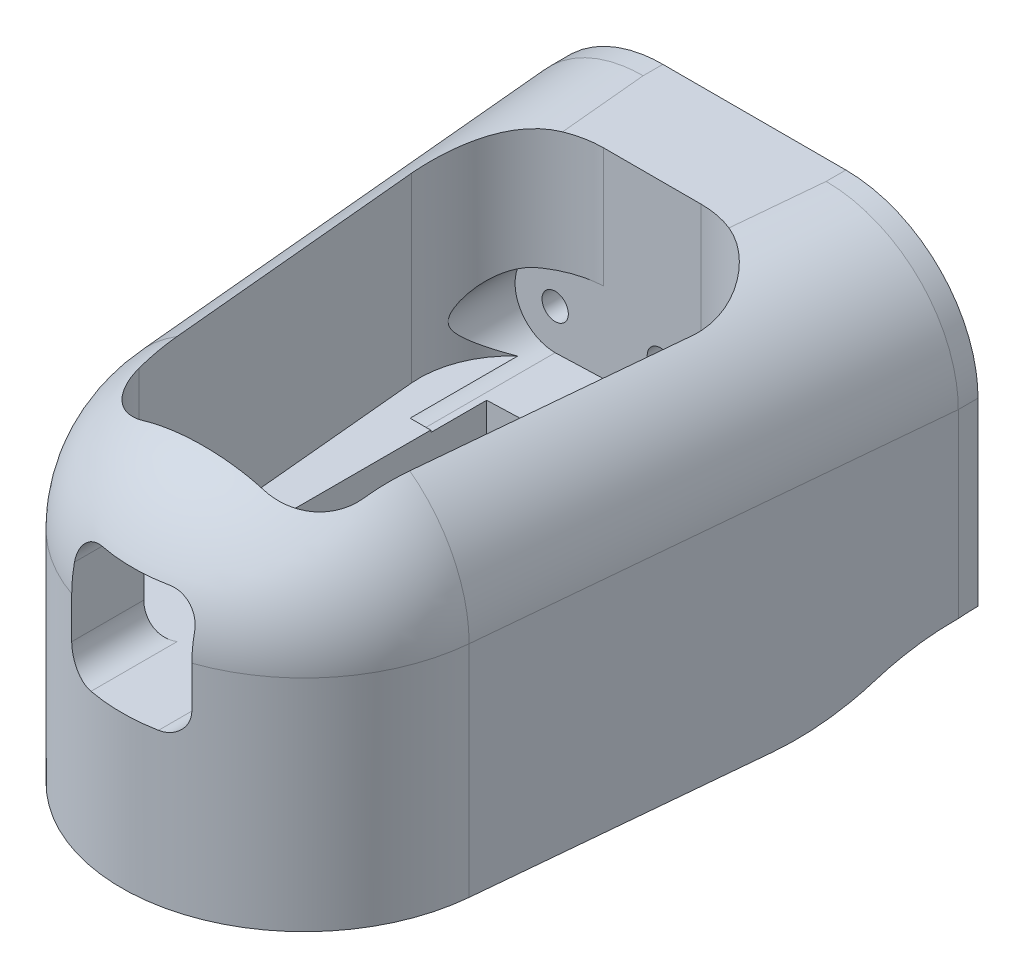
from build123d import *

# Parameters (mm, degrees)
SKETCH1_W               = 34
SKETCH1_H               = 23.7
BOSS_EXTRUDE1_DEPTH     = 46.6
SKETCH2_OUTSIDE_W       = 48.472
SKETCH2_OUTSIDE_H       = 61.072
CUT_EXTRUDE1_DEPTH      = 55.974994316
SERVO_START             = -64.298176616
SERVO_MICRO_OUTLINE_W   = 22.6
SERVO_MICRO_OUTLINE_H   = 12.4
SERVO_MICRO_DEPTH       = 22.3
SERVO_START_2           = -41.998176616
SERVO_MICRO_2_DEPTH     = 4.3
SERVO_START_3           = -48.648176616
SERVO_MICRO_3_DEPTH     = 2.4
SERVO_START_4           = -37.698176616
SERVO_MICRO_4_OUTLINE_R = 2.5
SERVO_MICRO_4_DEPTH     = 3.3
SERVO_START_5           = -20.114739751
SERVO_MICRO_5_OUTLINE_R = 0.6
SERVO_MICRO_5_DEPTH     = 2.3
SERVO_MICRO_6_OUTLINE_R = 0.6
SERVO_MICRO_6_DEPTH     = 2.3
SERVO_MICRO_7_OUTLINE_R = 0.6
SERVO_MICRO_7_DEPTH     = 2.3
BODY_MOVE_COPY1_ANGLE   = 180
CUT_EXTRUDE17_DEPTH     = 55.974994316
FILLET1_R               = 10
SKETCH5_R               = 6.85
CUT_EXTRUDE2_DEPTH      = 54.262745078
SKETCH7_W               = 13.7
SKETCH7_H               = 23.25
CUT_EXTRUDE3_DEPTH      = 4.4
SKETCH6_R               = 0.5
CUT_EXTRUDE4_DEPTH      = 4.5
SKETCH8_W               = 7.5
SKETCH8_H               = 4.867635741
CUT_EXTRUDE5_DEPTH      = 54.317562897
FILLET2_R               = 13
CUT_EXTRUDE6_DEPTH      = 15.15
FILLET3_R               = 7
FILLET4_R               = 4
SKETCH19_W              = 22
SKETCH19_H              = 8.5
BOSS_EXTRUDE2_DEPTH     = 1.5
FILLET6_R               = 1
SKETCH21_R              = 1
CUT_EXTRUDE9_DEPTH      = 10
CUT_EXTRUDE11_DEPTH     = 10
BOSS_EXTRUDE3_DEPTH     = 3
FILLET10_R              = 18
FILLET11_R              = 18
SKETCH28_W              = 9.132716588
SKETCH28_H              = 9.132716589
CUT_EXTRUDE18_DEPTH     = 48.549395493
FILLET15_R              = 2


with BuildPart() as part:
    # Sketch1 → Boss-Extrude1 (new body)
    with BuildSketch(Plane.XY):
        Rectangle(SKETCH1_W, SKETCH1_H)
    extrude(amount=BOSS_EXTRUDE1_DEPTH)

    # Sketch2 outside → Cut-Extrude1 (cut, through all)
    with BuildSketch(Plane(origin=(0, 11.85, 0), x_dir=(1, 0, 0), z_dir=(0, 1, 0))):
        with Locations((0, -23.3)):
            Rectangle(SKETCH2_OUTSIDE_W, SKETCH2_OUTSIDE_H)
        Polygon((-17, 0), (-12.648335779, -46.6), (12.648335779, -46.6), (17, 0), align=None, mode=Mode.SUBTRACT)
    extrude(amount=-CUT_EXTRUDE1_DEPTH, mode=Mode.SUBTRACT)


with BuildPart() as body_2:
    # Servo Micro: read off the stored shape, not the designer's step
    # Servo Micro outline → Servo Micro (new body)
    with BuildSketch(Plane(origin=(0, 0, 0), x_dir=(1, 0, 0), z_dir=(0, 1, 0)).offset(SERVO_START)):
        with Locations((-6.514739751, 13.686081941)):
            Rectangle(SERVO_MICRO_OUTLINE_W, SERVO_MICRO_OUTLINE_H)
    extrude(amount=SERVO_MICRO_DEPTH)

    # Servo Micro 2 outline → Servo Micro 2 (add)
    with BuildSketch(Plane(origin=(0, 0, 0), x_dir=(1, 0, 0), z_dir=(0, 1, 0)).offset(SERVO_START_2)):
        with BuildLine():
            ThreePointArc((-5.548073084, 14.964970347), (-17.814739751, 13.686081941), (-5.548073084, 12.407193535))
            ThreePointArc((-5.548073084, 12.407193535), (-4.014739751, 13.686081941), (-5.548073084, 14.964970347))
        make_face()
    extrude(amount=SERVO_MICRO_2_DEPTH)

    # Servo Micro 3 outline → Servo Micro 3 (add)
    with BuildSketch(Plane(origin=(0, 0, 0), x_dir=(1, 0, 0), z_dir=(0, 1, 0)).offset(SERVO_START_3)):
        with BuildLine():
            Line((8.120424904, 14.236081941), (9.785260249, 14.236081941))
            Line((9.785260249, 14.236081941), (9.785260249, 19.886081941))
            Line((9.785260249, 19.886081941), (4.785260249, 19.886081941))
            Line((4.785260249, 19.886081941), (4.785260249, 7.486081941))
            Line((4.785260249, 7.486081941), (9.785260249, 7.486081941))
            Line((9.785260249, 7.486081941), (9.785260249, 13.136081941))
            Line((9.785260249, 13.136081941), (8.120424904, 13.136081941))
            ThreePointArc((8.120424904, 13.136081941), (6.285260249, 13.686081941), (8.120424904, 14.236081941))
        make_face()
        with BuildLine():
            Line((-17.814739751, 7.486081941), (-17.814739751, 19.886081941))
            Line((-17.814739751, 19.886081941), (-22.814739751, 19.886081941))
            Line((-22.814739751, 19.886081941), (-22.814739751, 14.236081941))
            Line((-22.814739751, 14.236081941), (-21.149904405, 14.236081941))
            ThreePointArc((-21.149904405, 14.236081941), (-19.314739751, 13.686081941), (-21.149904405, 13.136081941))
            Line((-21.149904405, 13.136081941), (-22.814739751, 13.136081941))
            Line((-22.814739751, 13.136081941), (-22.814739751, 7.486081941))
            Line((-22.814739751, 7.486081941), (-17.814739751, 7.486081941))
        make_face()
    extrude(amount=SERVO_MICRO_3_DEPTH)

    # Servo Micro 4 outline → Servo Micro 4 (add)
    with BuildSketch(Plane(origin=(0, 0, 0), x_dir=(1, 0, 0), z_dir=(0, 1, 0)).offset(SERVO_START_4)):
        with Locations((-11.614739751, 13.686081941)):
            Circle(SERVO_MICRO_4_OUTLINE_R)
    extrude(amount=SERVO_MICRO_4_DEPTH)


with BuildPart() as body_3:
    # Servo Micro 5 outline → Servo Micro 5 (new body)
    with BuildSketch(Plane.YZ.offset(SERVO_START_5)):
        with Locations((-59.798176616, -12.486081941)):
            Circle(SERVO_MICRO_5_OUTLINE_R)
    extrude(amount=SERVO_MICRO_5_DEPTH)


with BuildPart() as body_4:
    # Servo Micro 6 outline → Servo Micro 6 (new body)
    with BuildSketch(Plane.YZ.offset(SERVO_START_5)):
        with Locations((-59.798176616, -14.886081941)):
            Circle(SERVO_MICRO_6_OUTLINE_R)
    extrude(amount=SERVO_MICRO_6_DEPTH)


with BuildPart() as body_5:
    # Servo Micro 7 outline → Servo Micro 7 (new body)
    with BuildSketch(Plane.YZ.offset(SERVO_START_5)):
        with Locations((-59.798176616, -13.686081941)):
            Circle(SERVO_MICRO_7_OUTLINE_R)
    extrude(amount=SERVO_MICRO_7_DEPTH)


with BuildPart() as body_2_1:
    # Body-Move/Copy1: read off the stored shape, not the designer's step
    # Body-Move/Copy1: moved
    add(body_2.part.moved(Location((-16.7852602, 49.5481766, 13.6860819))).rotate(Axis((0, 0, 0), (0.7071067812, 0, -0.7071067812)), BODY_MOVE_COPY1_ANGLE))


with BuildPart() as part_1:
    add(part.part)

    # Combine1: cut body 2
    add(body_2_1.part, mode=Mode.SUBTRACT)

    # Sketch26 → Cut-Extrude17 (cut, through all)
    with BuildSketch(Plane.XZ.offset(11.85)):
        with BuildLine():
            ThreePointArc((1.33e-07, 46.6), (9.35027243, 42.979603257), (13.824363162, 34.006455719))
            Line((13.824363162, 34.006455719), (12.648335779, 46.6))
            Line((12.648335779, 46.6), (1.33e-07, 46.6))
        make_face()
        with BuildLine():
            ThreePointArc((-13.824363162, 34.006455719), (-9.350272332, 42.979603346), (1.33e-07, 46.6))
            Line((1.33e-07, 46.6), (-12.648335779, 46.6))
            Line((-12.648335779, 46.6), (-13.824363162, 34.006455719))
        make_face()
    extrude(amount=-CUT_EXTRUDE17_DEPTH, mode=Mode.SUBTRACT)

    # Fillet1
    # the kernel refuses this fillet: 10 mm, written as the material it takes off along each edge
    with BuildSketch(Plane(origin=(-19.324470594, 11.85, -24.891702161), x_dir=(0.9956680864267025, 0, -0.09297882377933454), z_dir=(0.09297882377933454, 0, 0.9956680864267025)), Plane(origin=(13.824363162, 11.85, 34.006455719), x_dir=(-0.9956680864267025, 0, -0.09297882377933435), z_dir=(0.09297882377933435, 0, -0.9956680864267025))) as fillet1_piece_1:
        with BuildLine():
            CenterArc((FILLET1_R, -FILLET1_R), FILLET1_R, 90, 90)
            Line((0, -FILLET1_R), (0, 0))
            Line((0, 0), (FILLET1_R, 0))
        make_face()
    extrude(amount=59.15440967, mode=Mode.SUBTRACT)
    with BuildSketch(Plane(origin=(0, 11.85, 32.715490342), x_dir=(0.9956680864267025, 0, 0.09297882377933533), z_dir=(0.09297882377933533, 0, -0.9956680864267025))) as fillet1_piece_2:
        with BuildLine():
            CenterArc((13.884509658 - FILLET1_R, FILLET1_R), FILLET1_R, 270, 90)
            Line((13.884509658, FILLET1_R), (13.884509658, 0))
            Line((13.884509658, 0), (13.884509658 - FILLET1_R, 0))
        make_face()
    revolve(axis=Axis((0, 11.85, 32.715490342), (0, -1, 0)), revolution_arc=169.33, mode=Mode.SUBTRACT)

    # Sketch5 → Cut-Extrude2 (cut, through all)
    with BuildSketch(Plane(origin=(0, -7.55, 0), x_dir=(1, 0, 0), z_dir=(0, 1, 0))):
        with Locations((0, -28.4)):
            Circle(SKETCH5_R)
    extrude(amount=-CUT_EXTRUDE2_DEPTH, mode=Mode.SUBTRACT)


with BuildPart() as body_2_2:
    # Split2: read off the stored shape, not the designer's step
    # Split2: the piece on the far side of the plane
    add(part_1.part)
    split(bisect_by=Plane(origin=(0, -3.3, 0), x_dir=(1, 0, 0), z_dir=(0, 1, 0)), keep=Keep.BOTTOM)

    # Sketch7 → Cut-Extrude3 (cut)
    with BuildSketch(Plane(origin=(0, -3.3, 0), x_dir=(1, 0, 0), z_dir=(0, 1, 0))):
        with Locations((0, -23.625)):
            Rectangle(SKETCH7_W, SKETCH7_H)
    extrude(amount=-CUT_EXTRUDE3_DEPTH, mode=Mode.SUBTRACT)

    # Sketch6 → Cut-Extrude4 (cut)
    with BuildSketch(Plane(origin=(0, -3.3, 0), x_dir=(1, 0, 0), z_dir=(0, 1, 0))):
        with Locations(Location((0, -9.5, 0), (0, 0, 270))):
            Circle(SKETCH6_R)
        with Locations(Location((0, -37.1, 0), (0, 0, 270))):
            Circle(SKETCH6_R)
    extrude(amount=-CUT_EXTRUDE4_DEPTH, mode=Mode.SUBTRACT)

    # Sketch8 → Cut-Extrude5 (cut, through all)
    with BuildSketch(Plane(origin=(0, -7.7, 0), x_dir=(1, 0, 0), z_dir=(0, 1, 0))):
        with Locations((0, -20.233817871)):
            Rectangle(SKETCH8_W, SKETCH8_H)
    extrude(amount=-CUT_EXTRUDE5_DEPTH, mode=Mode.SUBTRACT)

    # Fillet2
    # the kernel refuses this fillet: 13 mm, written as the material it takes off along each edge
    with BuildSketch(Plane(origin=(-3.75, 4.598490397, 22.667635741), x_dir=(-0.7025345821324701, 0, 0.7116496054294947), z_dir=(0, -1, 0))) as fillet2_piece_1_section:
        with BuildLine():
            CenterArc((5.632063232, 12.707490795), FILLET2_R, 225.369290746, 32.453341255)
            Line((-3.500886335, 3.456045925), (0, 0))
            ThreePointArc((0, 0), (1.44493008, 0.15412985), (2.88986016, 0))
        make_face()
    fillet2_piece_1 = extrude(amount=28.746980774, mode=Mode.PRIVATE)
    fillet2_piece_1 = split(fillet2_piece_1, bisect_by=Plane(origin=(-3.75, 4.598490397, 17.8), z_dir=(0, 0, 1)), keep=Keep.TOP, mode=Mode.PRIVATE)
    add(fillet2_piece_1, mode=Mode.SUBTRACT)
    with BuildSketch(Plane(origin=(3.75, 4.598490397, 22.667635741), x_dir=(0.7025345821325057, 0, 0.7116496054294597), z_dir=(0, -1, 0))) as fillet2_piece_2_section:
        with BuildLine():
            CenterArc((5.632063232, -12.707490795), FILLET2_R, 102.177368, 32.453341255)
            Line((-3.500886335, -3.456045925), (0, 0))
            ThreePointArc((0, 0), (1.44493008, -0.15412985), (2.88986016, 0))
        make_face()
    fillet2_piece_2 = extrude(amount=28.746980791, mode=Mode.PRIVATE)
    fillet2_piece_2 = split(fillet2_piece_2, bisect_by=Plane(origin=(3.75, 4.598490397, 17.8), z_dir=(0, 0, 1)), keep=Keep.TOP, mode=Mode.PRIVATE)
    add(fillet2_piece_2, mode=Mode.SUBTRACT)


with BuildPart() as part_2:
    add(part_1.part)

    # Split2
    split(bisect_by=Plane(origin=(0, -3.3, 0), x_dir=(1, 0, 0), z_dir=(0, 1, 0)), keep=Keep.TOP)

    # Combine2: read off the stored shape, not the designer's step
    # Combine2: union body 2 2
    add(body_2_2.part)

    # Sketch11 → Cut-Extrude6 (cut)
    with BuildSketch(Plane(origin=(0, 11.85, 0), x_dir=(1, 0, 0), z_dir=(0, 1, 0))):
        Polygon((-8.210227928, -40.35), (-11.394600244, -6.25), (11.394600244, -6.25), (8.210227928, -40.35), align=None)
    extrude(amount=-CUT_EXTRUDE6_DEPTH, mode=Mode.SUBTRACT)

    # Fillet3
    fillet3_edges = [part_2.edges().sort_by_distance(p)[0] for p in [
        (-11.394600244, 3.605127019, 6.25),
        (11.394600244, 3.605127019, 6.25),
    ]]
    fillet(fillet3_edges, radius=FILLET3_R)

    # Fillet4
    fillet4_edges = [part_2.edges().sort_by_distance(p)[0] for p in [
        (-8.210227928, 2.677863716, 40.35),
        (8.210227928, 2.677863716, 40.35),
    ]]
    fillet(fillet4_edges, radius=FILLET4_R)

    # Sketch19 → Boss-Extrude2 (add)
    with BuildSketch(Plane(origin=(0, 0, 0), x_dir=(-1, 0, 0), z_dir=(0, 0, -1))):
        with BuildLine():
            add(Edge.make_bspline(
                [(-6.956492393, 11.85), (-17, 11.85), (-17, 1.85)],
                knots=[1.570796327, 1.570796327, 1.570796327, 3.141592654, 3.141592654, 3.141592654], degree=2, weights=[1, 0.707106781, 1]))
            Line((-17, 1.85), (-17, -11.85))
            Line((-17, -11.85), (17, -11.85))
            Line((17, -11.85), (17, 1.85))
            add(Edge.make_bspline(
                [(17, 1.85), (17, 11.85), (6.956492393, 11.85)],
                knots=[0, 0, 0, 1.570796327, 1.570796327, 1.570796327], degree=2, weights=[1, 0.707106781, 1]))
            Line((6.956492393, 11.85), (-6.956492393, 11.85))
        make_face()
        with Locations((1, 0)):
            Rectangle(SKETCH19_W, SKETCH19_H, mode=Mode.SUBTRACT)
    extrude(amount=BOSS_EXTRUDE2_DEPTH)

    # Fillet6
    fillet6_edges = [part_2.edges().sort_by_distance(p)[0] for p in [
        (10, 4.25, -0.75),
        (-12, 4.25, -0.75),
        (-12, -4.25, -0.75),
        (10, -4.25, -0.75),
    ]]
    fillet(fillet6_edges, radius=FILLET6_R)

    # Sketch21 → Cut-Extrude9 (cut)
    with BuildSketch(Plane(origin=(0, 0, 0), x_dir=(-1, 0, 0), z_dir=(0, 0, -1))):
        with Locations((-0.602633724, -0.153936932)):
            Circle(SKETCH21_R)
        with Locations((7.3926841, -0.427602588)):
            Circle(SKETCH21_R)
    extrude(amount=-CUT_EXTRUDE9_DEPTH, mode=Mode.SUBTRACT)

    # Sketch22 → Cut-Extrude11 (cut)
    with BuildSketch(Plane.XY.offset(6.25)):
        with BuildLine():
            Line((-7.3926841, 2.622397412), (0.602633724, 2.896063068))
            ThreePointArc((0.602633724, 2.896063068), (3.652633724, -0.153936932), (0.602633724, -3.203936932))
            Line((0.602633724, -3.203936932), (-7.3926841, -3.477602588))
            ThreePointArc((-7.3926841, -3.477602588), (-10.4426841, -0.427602588), (-7.3926841, 2.622397412))
        make_face()
    extrude(amount=CUT_EXTRUDE11_DEPTH, mode=Mode.SUBTRACT)

    # Sketch23 → Boss-Extrude3 (add)
    with BuildSketch(Plane.XZ.offset(11.85)):
        with BuildLine():
            Line((-13.824363162, 34.006455719), (-16.206241505, 8.5))
            Line((-16.206241505, 8.5), (16.206241505, 8.5))
            Line((16.206241505, 8.5), (13.824363162, 34.006455719))
            ThreePointArc((13.824363162, 34.006455719), (0, 46.6), (-13.824363162, 34.006455719))
        make_face()
        with BuildLine():
            ThreePointArc((5.780190916, 24.724147314), (4.275065431, 21.40575265), (3.75, 17.8))
            Line((3.75, 17.8), (-3.75, 17.8))
            ThreePointArc((-3.75, 17.8), (-4.275065431, 21.40575265), (-5.780190916, 24.724147314))
            ThreePointArc((-5.780190916, 24.724147314), (0, 35.25), (5.780190916, 24.724147314))
        make_face(mode=Mode.SUBTRACT)
    extrude(amount=BOSS_EXTRUDE3_DEPTH)

    # Fillet10
    # the kernel refuses this fillet: 18 mm, written as the material it adds along each edge
    with BuildSketch(Plane(origin=(-41.080927432, -11.85, 8.5), x_dir=(0, -1, 0), z_dir=(1, 0, 0))) as fillet10_piece_1_section:
        with BuildLine():
            CenterArc((18, 9.949874371), FILLET10_R, 180, 33.557309762)
            Line((0, 9.949874371), (-0.36, 9.949874371))
            Line((-0.36, 9.949874371), (-0.36, 0))
            Line((-0.36, 0), (0, -0.36))
            ThreePointArc((0, -0.36), (1.5, -0.36), (2.7, -0.198997487))
            Line((2.7, -0.198997487), (3, 0))
        make_face()
    fillet10_piece_1 = extrude(amount=82.161854865, mode=Mode.PRIVATE)
    fillet10_piece_1 = split(fillet10_piece_1, bisect_by=Plane(origin=(-16.421284699, -11.85, 6.197199893), z_dir=(0.9956680864267025, 0, -0.09297882377933454)), keep=Keep.TOP, mode=Mode.PRIVATE)
    fillet10_piece_1 = split(fillet10_piece_1, bisect_by=Plane(origin=(15.710990396, -11.85, 13.803419676), z_dir=(-0.9956680864267025, 0, -0.09297882377933435)), keep=Keep.TOP, mode=Mode.PRIVATE)
    fillet10_piece_1 = split(fillet10_piece_1, bisect_by=Plane(origin=(-17, -11.85, 8.5), z_dir=(1, 0, 0)), keep=Keep.TOP, mode=Mode.PRIVATE)
    fillet10_piece_1 = split(fillet10_piece_1, bisect_by=Plane(origin=(17, -11.85, 8.5), z_dir=(-1, 0, 0)), keep=Keep.TOP, mode=Mode.PRIVATE)
    add(fillet10_piece_1)

    # Fillet11
    fillet11_edges = [part_2.edges().sort_by_distance(p)[0] for p in [
        (0, -14.85, 8.5),
    ]]
    fillet(fillet11_edges, radius=FILLET11_R)

    # Sketch28 → Cut-Extrude18 (cut, through all)
    with BuildSketch(Plane(origin=(0, 0, 40.35), x_dir=(-1, 0, 0), z_dir=(0, 0, -1))):
        with Locations((0, 1.266358295)):
            Rectangle(SKETCH28_W, SKETCH28_H)
    extrude(amount=-CUT_EXTRUDE18_DEPTH, mode=Mode.SUBTRACT)

    # Fillet15
    fillet15_edges = [part_2.edges().sort_by_distance(p)[0] for p in [
        (4.566358294, -3.3, 43.08881069),
        (-4.566358294, -3.3, 43.08881069),
        (4.566358294, 5.832716589, 42.649084882),
        (-4.566358294, 5.832716589, 42.649084882),
    ]]
    fillet(fillet15_edges, radius=FILLET15_R)


solid = part_2.part
